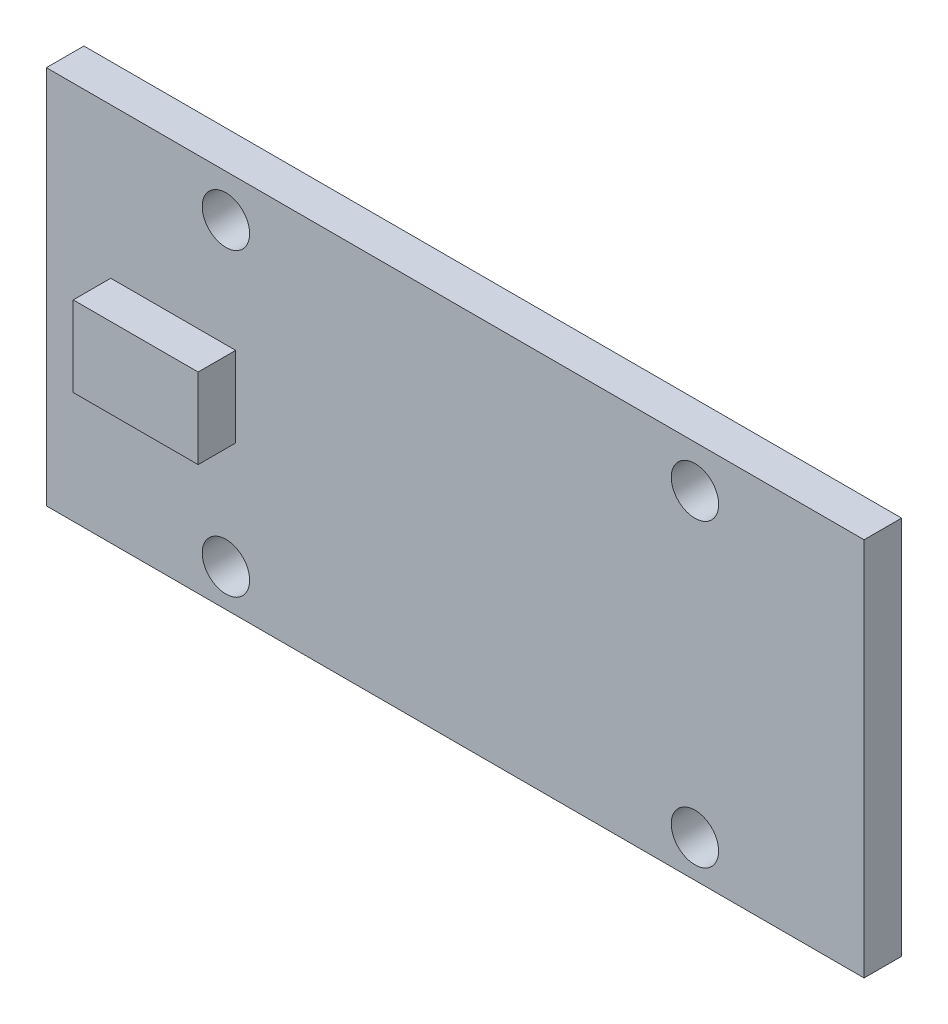
from build123d import *

# Parameters (mm, degrees)
SKETCH2_W               = 55.351920974
SKETCH2_H               = 25.692475641
SKETCH2_R               = 1.604575537
BOSS_EXTRUDE1_DEPTH     = 2.54
BOSS_EXTRUDE2_START     = 4.355808651
BOSS_EXTRUDE2_OUTLINE_W = 5.429648603
BOSS_EXTRUDE2_OUTLINE_H = 2.54
BOSS_EXTRUDE2_DEPTH     = 8.456135595


# Read off the part's stored shape, not the designer's step: Boss-Extrude2
with BuildPart() as part:
    # Sketch2 → Boss-Extrude1 (new body)
    with BuildSketch(Plane.XY):
        with Locations((27.675960487, 12.846237821)):
            Rectangle(SKETCH2_W, SKETCH2_H)
        with Locations((12.152179379, 2.513985209)):
            Circle(SKETCH2_R, mode=Mode.SUBTRACT)
        with Locations((43.902179379, 2.513985209)):
            Circle(SKETCH2_R, mode=Mode.SUBTRACT)
        with Locations((43.902179379, 22.833985209)):
            Circle(SKETCH2_R, mode=Mode.SUBTRACT)
        with Locations((12.152179379, 22.833985209)):
            Circle(SKETCH2_R, mode=Mode.SUBTRACT)
    extrude(amount=BOSS_EXTRUDE1_DEPTH)

    # Boss-Extrude2 outline → Boss-Extrude2 (add)
    with BuildSketch(Plane.YZ.offset(BOSS_EXTRUDE2_START)):
        with Locations((12.810955728, 3.81)):
            Rectangle(BOSS_EXTRUDE2_OUTLINE_W, BOSS_EXTRUDE2_OUTLINE_H)
    extrude(amount=BOSS_EXTRUDE2_DEPTH)


solid = part.part
